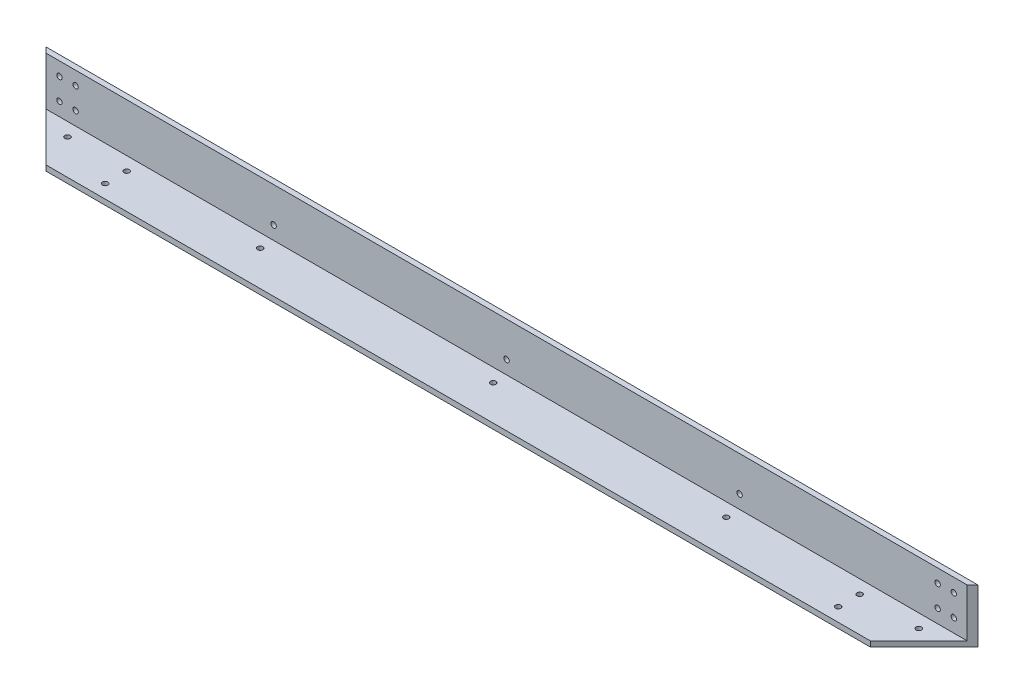
from build123d import *

# Parameters (mm, degrees)
BOSS_EXTRUDE1_DEPTH          = 550
CHAMFER6_SIZE                = 31.75
CHAMFER7_SIZE                = 31.75
TOPHOLES_SKETCH3_R           = 1.5875
TOPHOLES_CUT_EXTRUDE2_DEPTH  = 552.656227306
SIDEHOLES_SKETCH4_R          = 1.5875
SIDEHOLES_CUT_EXTRUDE3_DEPTH = 552.656227306


with BuildPart() as part:
    # Sketch1 → Boss-Extrude1 (new body)
    with BuildSketch(Plane(origin=(0, 0, 0), x_dir=(0, 0, -1), z_dir=(1, 0, 0))):
        Polygon((0, 0), (-31.75, 0), (-31.75, 3.175), (-3.175, 3.175), (-3.175, 31.75), (0, 31.75), align=None)
    extrude(amount=BOSS_EXTRUDE1_DEPTH)

    # Chamfer6
    chamfer6_edges = [part.edges().sort_by_distance(p)[0] for p in [
        (550, 1.5875, 31.75),
    ]]
    chamfer(chamfer6_edges, length=CHAMFER6_SIZE - 0.0001)  # a hair under: the kernel refuses the full size

    # Chamfer7
    chamfer7_edges = [part.edges().sort_by_distance(p)[0] for p in [
        (0, 1.5875, 31.75),
    ]]
    chamfer(chamfer7_edges, length=CHAMFER7_SIZE - 0.0001)  # a hair under: the kernel refuses the full size

    # TopHoles-Sketch3 → TopHoles-Cut-Extrude2 (cut, through all)
    with BuildSketch(Plane(origin=(0, 3.175, 0), x_dir=(1, 0, 0), z_dir=(0, 1, 0))):
        with Locations(Location((58.7375, -23.8125, 0), (0, 0, 270))):
            Circle(TOPHOLES_SKETCH3_R)
        with Locations(Location((491.2625, -23.8125, 0), (0, 0, 270))):
            Circle(TOPHOLES_SKETCH3_R)
        with Locations(Location((491.2625, -11.1125, 0), (0, 0, 270))):
            Circle(TOPHOLES_SKETCH3_R)
        with Locations(Location((58.7375, -11.1125, 0), (0, 0, 270))):
            Circle(TOPHOLES_SKETCH3_R)
        with Locations(Location((526.1875, -11.1125, 0), (0, 0, 270))):
            Circle(TOPHOLES_SKETCH3_R)
        with Locations(Location((23.8125, -11.1125, 0), (0, 0, 270))):
            Circle(TOPHOLES_SKETCH3_R)
        with Locations(Location((275, -11.1125, 0), (0, 0, 270))):
            Circle(TOPHOLES_SKETCH3_R)
        with Locations(Location((137.5, -11.1125, 0), (0, 0, 270))):
            Circle(TOPHOLES_SKETCH3_R)
        with Locations(Location((412.5, -11.1125, 0), (0, 0, 270))):
            Circle(TOPHOLES_SKETCH3_R)
    extrude(amount=-TOPHOLES_CUT_EXTRUDE2_DEPTH, mode=Mode.SUBTRACT)

    # SideHoles-Sketch4 → SideHoles-Cut-Extrude3 (cut, through all)
    with BuildSketch(Plane.XY.offset(3.175)):
        with Locations((11.1125, 23.8125)):
            Circle(SIDEHOLES_SKETCH4_R)
        with Locations((529.3625, 23.8125)):
            Circle(SIDEHOLES_SKETCH4_R)
        with Locations((20.6375, 23.8125)):
            Circle(SIDEHOLES_SKETCH4_R)
        with Locations((538.8875, 23.8125)):
            Circle(SIDEHOLES_SKETCH4_R)
        with Locations((11.1125, 11.1125)):
            Circle(SIDEHOLES_SKETCH4_R)
        with Locations((20.6375, 11.1125)):
            Circle(SIDEHOLES_SKETCH4_R)
        with Locations((529.3625, 11.1125)):
            Circle(SIDEHOLES_SKETCH4_R)
        with Locations((538.8875, 11.1125)):
            Circle(SIDEHOLES_SKETCH4_R)
        with Locations((137.5, 11.1125)):
            Circle(SIDEHOLES_SKETCH4_R)
        with Locations((275, 11.1125)):
            Circle(SIDEHOLES_SKETCH4_R)
        with Locations((412.5, 11.1125)):
            Circle(SIDEHOLES_SKETCH4_R)
    extrude(amount=-SIDEHOLES_CUT_EXTRUDE3_DEPTH, mode=Mode.SUBTRACT)


solid = part.part
